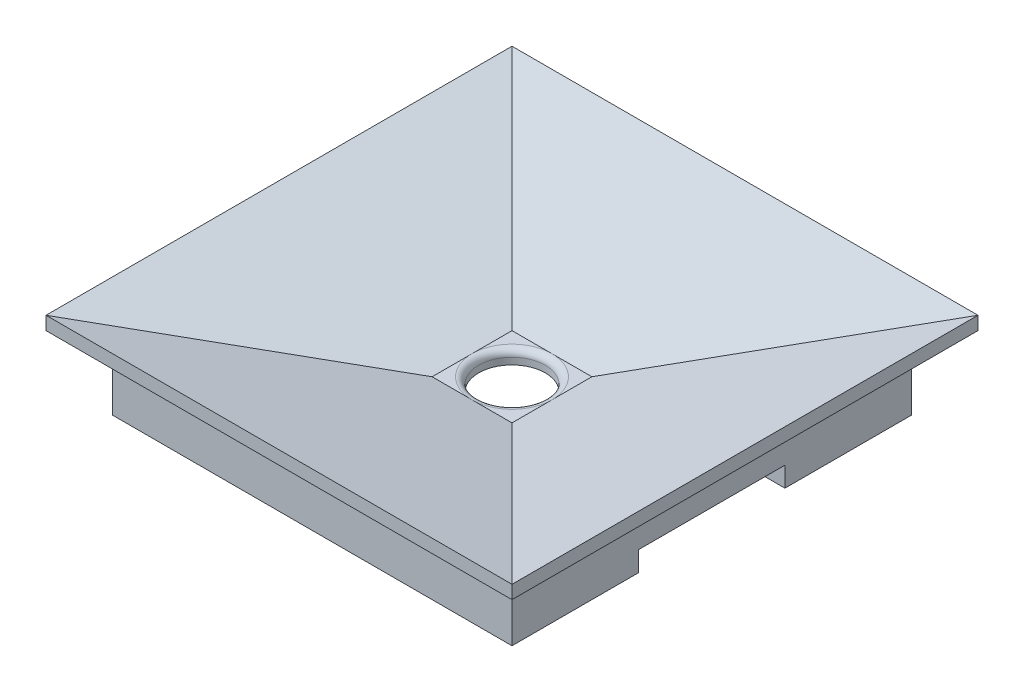
from build123d import *

# Parameters (mm, degrees)
SKETCH1_W            = 60
SKETCH1_H            = 60
BOSS_EXTRUDE1_DEPTH  = 6
SKETCH7_W            = 60
SKETCH7_H            = 60
SKETCH7_W_2          = 56
SKETCH7_H_2          = 56
BOSS_EXTRUDE4_DEPTH  = 7
SKETCH8_W            = 70
SKETCH8_H            = 70
SKETCH8_W_2          = 60
SKETCH8_H_2          = 60
BOSS_EXTRUDE5_DEPTH  = 2
SKETCH12_W           = 56
SKETCH12_H           = 56
BOSS_EXTRUDE10_DEPTH = 7
SKETCH13_W           = 12
SKETCH13_H           = 12
CUT_EXTRUDE3_DEPTH   = 8
SKETCH3_R            = 5
CUT_EXTRUDE4_DEPTH   = 52.17616649
SKETCH2_R            = 0.925
CUT_EXTRUDE5_DEPTH   = 3
SKETCH15_W           = 22
SKETCH15_H           = 4.335
SKETCH15_H_2         = 22
SKETCH15_R           = 5
SKETCH15_W_2         = 4.335
CUT_EXTRUDE6_DEPTH   = 3
SKETCH16_W           = 14.665
SKETCH16_H           = 22
CUT_EXTRUDE7_DEPTH   = 3
FILLET1_R            = 4
FILLET2_R            = 1


with BuildPart() as part:
    # Sketch1 → Boss-Extrude1 (new body)
    with BuildSketch(Plane(origin=(0, 0, 0), x_dir=(1, 0, 0), z_dir=(0, 1, 0))):
        Rectangle(SKETCH1_W, SKETCH1_H)
    extrude(amount=BOSS_EXTRUDE1_DEPTH)

    # Sketch7 → Boss-Extrude4 (add)
    with BuildSketch(Plane(origin=(0, 6, 0), x_dir=(1, 0, 0), z_dir=(0, 1, 0))):
        Rectangle(SKETCH7_W, SKETCH7_H)
        Rectangle(SKETCH7_W_2, SKETCH7_H_2, mode=Mode.SUBTRACT)
    extrude(amount=BOSS_EXTRUDE4_DEPTH)

    # Sketch8 → Boss-Extrude5 (add)
    with BuildSketch(Plane(origin=(0, 13, 0), x_dir=(1, 0, 0), z_dir=(0, 1, 0))):
        Rectangle(SKETCH8_W, SKETCH8_H)
        Rectangle(SKETCH8_W_2, SKETCH8_H_2, mode=Mode.SUBTRACT)
    extrude(amount=-BOSS_EXTRUDE5_DEPTH)

    # Sketch12 → Boss-Extrude10 (add)
    with BuildSketch(Plane(origin=(0, 6, 0), x_dir=(1, 0, 0), z_dir=(0, 1, 0))):
        Rectangle(SKETCH12_W, SKETCH12_H)
    extrude(amount=BOSS_EXTRUDE10_DEPTH)

    # Sketch13 → Cut-Extrude3 (cut)
    with BuildSketch(Plane(origin=(0, 13, 0), x_dir=(1, 0, 0), z_dir=(0, 1, 0))):
        Rectangle(SKETCH13_W, SKETCH13_H)
    extrude(amount=-CUT_EXTRUDE3_DEPTH, mode=Mode.SUBTRACT)

    # Sketch14 → section 1 of cut_loft1
    with BuildSketch(Plane(origin=(0, 13, 0), x_dir=(1, 0, 0), z_dir=(0, 1, 0)), mode=Mode.PRIVATE) as cut_loft1_s1:
        with BuildLine():
            Line((-35, 35), (-35, -35))
            Line((-35, -35), (35, -35))
            Line((35, -35), (35, 35))
            Line((35, 35), (-35, 35))
        make_face()
    # loft from a face of the part (cut_loft1)
    loft([part.faces().sort_by_distance((0, 5, 0))[0], cut_loft1_s1.sketch], mode=Mode.SUBTRACT)

    # Sketch3 → Cut-Extrude4 (cut, through all)
    with BuildSketch(Plane.XZ):
        with Locations(Location((0, 0, 0), (0, 0, 270))):
            Circle(SKETCH3_R)
    extrude(amount=-CUT_EXTRUDE4_DEPTH, mode=Mode.SUBTRACT)

    # Sketch2 → Cut-Extrude5 (cut)
    with BuildSketch(Plane.XZ):
        with Locations(Location((-14, -13.335, 0), (0, 0, 270))):
            Circle(SKETCH2_R)
        with Locations(Location((14, -13.335, 0), (0, 0, 270))):
            Circle(SKETCH2_R)
        with Locations(Location((14, 13.335, 0), (0, 0, 270))):
            Circle(SKETCH2_R)
        with Locations(Location((-14, 13.335, 0), (0, 0, 270))):
            Circle(SKETCH2_R)
    extrude(amount=-CUT_EXTRUDE5_DEPTH, mode=Mode.SUBTRACT)

    # Sketch15 → Cut-Extrude6 (cut)
    # profile 1 of 5: a face of its own
    with BuildSketch(Plane.XZ):
        with Locations((0, -13.1675)):
            Rectangle(SKETCH15_W, SKETCH15_H)
    # profile 2 of 5: a face of its own
    with BuildSketch(Plane.XZ):
        Rectangle(SKETCH15_W, SKETCH15_H_2)
        with Locations(Location((0, 0, 0), (0, 0, 270))):
            Circle(SKETCH15_R, mode=Mode.SUBTRACT)
    # profile 3 of 5: a face of its own
    with BuildSketch(Plane.XZ):
        with Locations((-13.1675, 0)):
            Rectangle(SKETCH15_W_2, SKETCH15_H_2)
    # profile 4 of 5: a face of its own
    with BuildSketch(Plane.XZ):
        with Locations((0, 13.1675)):
            Rectangle(SKETCH15_W, SKETCH15_H)
    # profile 5 of 5: a face of its own
    with BuildSketch(Plane.XZ):
        with Locations((13.1675, 0)):
            Rectangle(SKETCH15_W_2, SKETCH15_H_2)
    extrude(amount=-CUT_EXTRUDE6_DEPTH, mode=Mode.SUBTRACT)

    # Sketch16 → Cut-Extrude7 (cut)
    with BuildSketch(Plane.XZ):
        with Locations((22.6675, 0)):
            Rectangle(SKETCH16_W, SKETCH16_H)
    extrude(amount=-CUT_EXTRUDE7_DEPTH, mode=Mode.SUBTRACT)

    # Fillet1
    fillet1_edges = [part.edges().sort_by_distance(p)[0] for p in [
        (11, 1.5, -11),
        (-11, 1.5, -11),
        (-11, 1.5, 11),
        (11, 1.5, 11),
    ]]
    fillet(fillet1_edges, radius=FILLET1_R)

    # Fillet2
    fillet2_edges = [part.edges().sort_by_distance(p)[0] for p in [
        (0, 5, 5),
    ]]
    fillet(fillet2_edges, radius=FILLET2_R - 0.0001)  # a hair under: the kernel refuses the full size


solid = part.part
